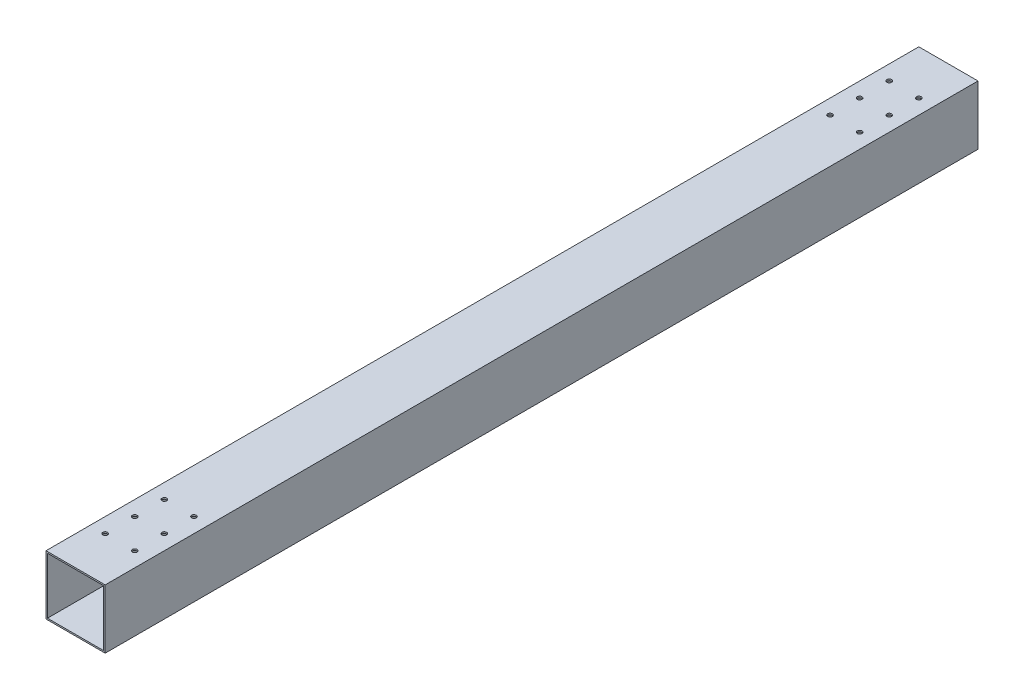
from build123d import *

# Parameters (mm, degrees)
SKETCH_1_W          = 40
SKETCH_1_H          = 40
SKETCH_1_W_2        = 38
SKETCH_1_H_2        = 38
EXTRUDE_1_DEPTH     = 295
CUT_EXTRUDE_2_REACH = 300.371
SKETCH_3_R          = 1.6


with BuildPart() as part:
    # 草图1 → 凸台-拉伸1 (new, symmetric)
    with BuildSketch(Plane.XY):
        Rectangle(SKETCH_1_W, SKETCH_1_H)
        Rectangle(SKETCH_1_W_2, SKETCH_1_H_2, mode=Mode.SUBTRACT)
    extrude(amount=EXTRUDE_1_DEPTH, both=True)

    # 草图3 → 切除-拉伸2 (cut, up to next)
    with BuildSketch(Plane(origin=(0, 20, 0), x_dir=(1, 0, 0), z_dir=(0, 1, 0)), mode=Mode.PRIVATE) as cut_extrude_2_sk1:
        with Locations((-10, 225)):
            Circle(SKETCH_3_R)
    cut_extrude_2_tool1 = extrude(cut_extrude_2_sk1.sketch, amount=-CUT_EXTRUDE_2_REACH, mode=Mode.PRIVATE) & part.part
    # 草图3 → 切除-拉伸2 (cut, up to next)
    with BuildSketch(Plane(origin=(0, 20, 0), x_dir=(1, 0, 0), z_dir=(0, 1, 0)), mode=Mode.PRIVATE) as cut_extrude_2_sk2:
        with Locations((10, 225)):
            Circle(SKETCH_3_R)
    cut_extrude_2_tool2 = extrude(cut_extrude_2_sk2.sketch, amount=-CUT_EXTRUDE_2_REACH, mode=Mode.PRIVATE) & part.part
    # 草图3 → 切除-拉伸2 (cut, up to next)
    with BuildSketch(Plane(origin=(0, 20, 0), x_dir=(1, 0, 0), z_dir=(0, 1, 0)), mode=Mode.PRIVATE) as cut_extrude_2_sk3:
        with Locations((10, 245)):
            Circle(SKETCH_3_R)
    cut_extrude_2_tool3 = extrude(cut_extrude_2_sk3.sketch, amount=-CUT_EXTRUDE_2_REACH, mode=Mode.PRIVATE) & part.part
    # 草图3 → 切除-拉伸2 (cut, up to next)
    with BuildSketch(Plane(origin=(0, 20, 0), x_dir=(1, 0, 0), z_dir=(0, 1, 0)), mode=Mode.PRIVATE) as cut_extrude_2_sk4:
        with Locations((-10, 245)):
            Circle(SKETCH_3_R)
    cut_extrude_2_tool4 = extrude(cut_extrude_2_sk4.sketch, amount=-CUT_EXTRUDE_2_REACH, mode=Mode.PRIVATE) & part.part
    # 草图3 → 切除-拉伸2 (cut, up to next)
    with BuildSketch(Plane(origin=(0, 20, 0), x_dir=(1, 0, 0), z_dir=(0, 1, 0)), mode=Mode.PRIVATE) as cut_extrude_2_sk5:
        with Locations((-10, 265)):
            Circle(SKETCH_3_R)
    cut_extrude_2_tool5 = extrude(cut_extrude_2_sk5.sketch, amount=-CUT_EXTRUDE_2_REACH, mode=Mode.PRIVATE) & part.part
    # 草图3 → 切除-拉伸2 (cut, up to next)
    with BuildSketch(Plane(origin=(0, 20, 0), x_dir=(1, 0, 0), z_dir=(0, 1, 0)), mode=Mode.PRIVATE) as cut_extrude_2_sk6:
        with Locations((10, 265)):
            Circle(SKETCH_3_R)
    cut_extrude_2_tool6 = extrude(cut_extrude_2_sk6.sketch, amount=-CUT_EXTRUDE_2_REACH, mode=Mode.PRIVATE) & part.part
    # 草图3 → 切除-拉伸2 (cut, up to next)
    with BuildSketch(Plane(origin=(0, 20, 0), x_dir=(1, 0, 0), z_dir=(0, 1, 0)), mode=Mode.PRIVATE) as cut_extrude_2_sk7:
        with Locations((10, -265)):
            Circle(SKETCH_3_R)
    cut_extrude_2_tool7 = extrude(cut_extrude_2_sk7.sketch, amount=-CUT_EXTRUDE_2_REACH, mode=Mode.PRIVATE) & part.part
    # 草图3 → 切除-拉伸2 (cut, up to next)
    with BuildSketch(Plane(origin=(0, 20, 0), x_dir=(1, 0, 0), z_dir=(0, 1, 0)), mode=Mode.PRIVATE) as cut_extrude_2_sk8:
        with Locations((-10, -265)):
            Circle(SKETCH_3_R)
    cut_extrude_2_tool8 = extrude(cut_extrude_2_sk8.sketch, amount=-CUT_EXTRUDE_2_REACH, mode=Mode.PRIVATE) & part.part
    # 草图3 → 切除-拉伸2 (cut, up to next)
    with BuildSketch(Plane(origin=(0, 20, 0), x_dir=(1, 0, 0), z_dir=(0, 1, 0)), mode=Mode.PRIVATE) as cut_extrude_2_sk9:
        with Locations((-10, -245)):
            Circle(SKETCH_3_R)
    cut_extrude_2_tool9 = extrude(cut_extrude_2_sk9.sketch, amount=-CUT_EXTRUDE_2_REACH, mode=Mode.PRIVATE) & part.part
    # 草图3 → 切除-拉伸2 (cut, up to next)
    with BuildSketch(Plane(origin=(0, 20, 0), x_dir=(1, 0, 0), z_dir=(0, 1, 0)), mode=Mode.PRIVATE) as cut_extrude_2_sk10:
        with Locations((10, -245)):
            Circle(SKETCH_3_R)
    cut_extrude_2_tool10 = extrude(cut_extrude_2_sk10.sketch, amount=-CUT_EXTRUDE_2_REACH, mode=Mode.PRIVATE) & part.part
    # 草图3 → 切除-拉伸2 (cut, up to next)
    with BuildSketch(Plane(origin=(0, 20, 0), x_dir=(1, 0, 0), z_dir=(0, 1, 0)), mode=Mode.PRIVATE) as cut_extrude_2_sk11:
        with Locations((10, -225)):
            Circle(SKETCH_3_R)
    cut_extrude_2_tool11 = extrude(cut_extrude_2_sk11.sketch, amount=-CUT_EXTRUDE_2_REACH, mode=Mode.PRIVATE) & part.part
    # 草图3 → 切除-拉伸2 (cut, up to next)
    with BuildSketch(Plane(origin=(0, 20, 0), x_dir=(1, 0, 0), z_dir=(0, 1, 0)), mode=Mode.PRIVATE) as cut_extrude_2_sk12:
        with Locations((-10, -225)):
            Circle(SKETCH_3_R)
    cut_extrude_2_tool12 = extrude(cut_extrude_2_sk12.sketch, amount=-CUT_EXTRUDE_2_REACH, mode=Mode.PRIVATE) & part.part
    add(cut_extrude_2_tool1.solids().sort_by_distance((-10, 20, -225))[0], mode=Mode.SUBTRACT)
    add(cut_extrude_2_tool2.solids().sort_by_distance((10, 20, -225))[0], mode=Mode.SUBTRACT)
    add(cut_extrude_2_tool3.solids().sort_by_distance((10, 20, -245))[0], mode=Mode.SUBTRACT)
    add(cut_extrude_2_tool4.solids().sort_by_distance((-10, 20, -245))[0], mode=Mode.SUBTRACT)
    add(cut_extrude_2_tool5.solids().sort_by_distance((-10, 20, -265))[0], mode=Mode.SUBTRACT)
    add(cut_extrude_2_tool6.solids().sort_by_distance((10, 20, -265))[0], mode=Mode.SUBTRACT)
    add(cut_extrude_2_tool7.solids().sort_by_distance((10, 20, 265))[0], mode=Mode.SUBTRACT)
    add(cut_extrude_2_tool8.solids().sort_by_distance((-10, 20, 265))[0], mode=Mode.SUBTRACT)
    add(cut_extrude_2_tool9.solids().sort_by_distance((-10, 20, 245))[0], mode=Mode.SUBTRACT)
    add(cut_extrude_2_tool10.solids().sort_by_distance((10, 20, 245))[0], mode=Mode.SUBTRACT)
    add(cut_extrude_2_tool11.solids().sort_by_distance((10, 20, 225))[0], mode=Mode.SUBTRACT)
    add(cut_extrude_2_tool12.solids().sort_by_distance((-10, 20, 225))[0], mode=Mode.SUBTRACT)


solid = part.part
